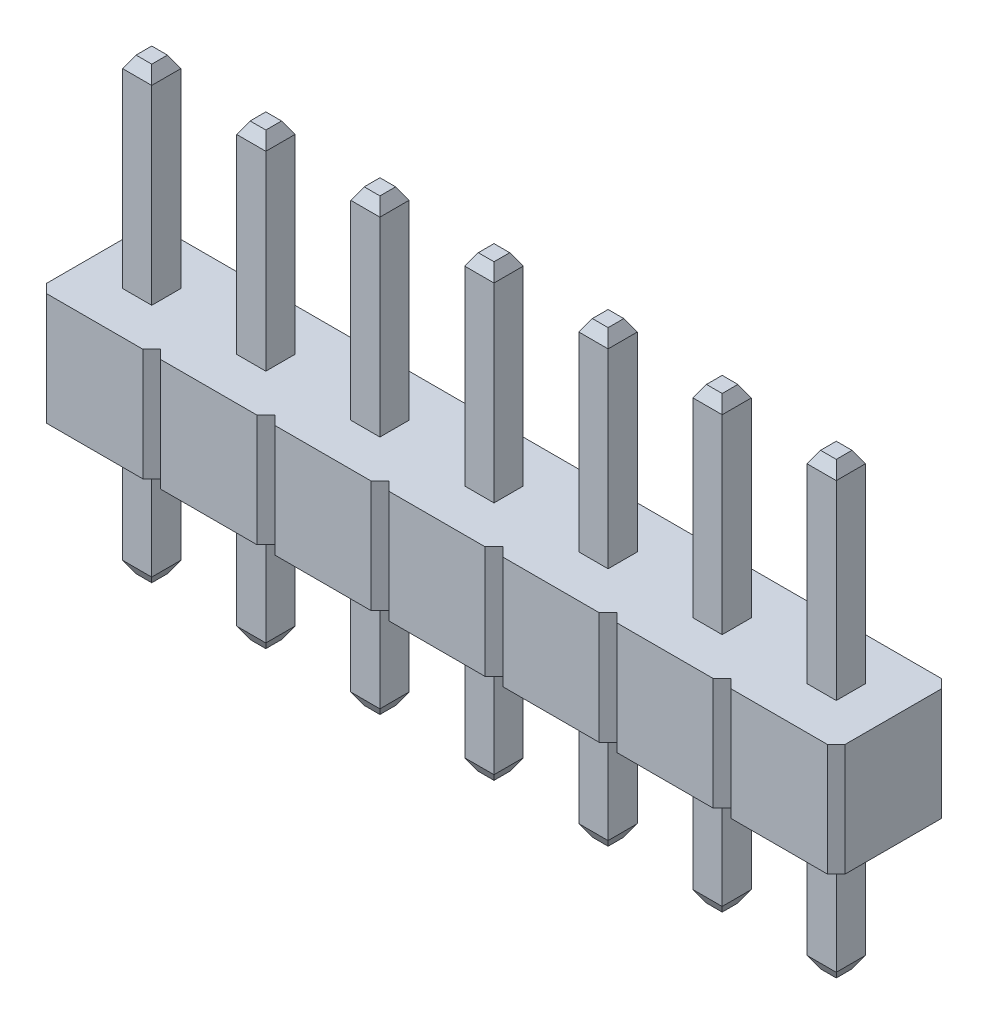
from build123d import *

# Parameters (mm, degrees)
BOSS_EXTRUDE1_DEPTH   = 2.5
SKETCH3_W             = 0.65
SKETCH3_H             = 0.65
BOSS_EXTRUDE2_DEPTH   = 10
CHAMFER2_SIZE         = 0.15
CHAMFER2_SIZE2        = 0.259807621
CHAMFER3_SIZE         = 0.15
CHAMFER3_SIZE2        = 0.259807621
LPATTERN2_DEPTH       = 2.5
LPATTERN2_START       = -2.740192379
LPATTERN2_2_OUTLINE_W = 0.65
LPATTERN2_2_OUTLINE_H = 0.65
LPATTERN2_2_DEPTH     = 9.480384758


with BuildPart() as part:
    # Sketch1 → Boss-Extrude1 (new body)
    with BuildSketch(Plane(origin=(0, 0, 0), x_dir=(1, 0, 0), z_dir=(0, 1, 0))):
        Polygon((-7.42, 1.27), (-7.62, 1.07), (-7.62, -1.07), (-7.42, -1.27), (-5.28, -1.27), (-5.08, -1.07), (-5.08, 1.07), (-5.28, 1.27), align=None)
    extrude(amount=BOSS_EXTRUDE1_DEPTH)

    # Sketch3 → Boss-Extrude2 (add)
    with BuildSketch(Plane(origin=(0, -3, 0), x_dir=(1, 0, 0), z_dir=(0, 1, 0))):
        with Locations((-6.35, 0)):
            Rectangle(SKETCH3_W, SKETCH3_H)
    extrude(amount=BOSS_EXTRUDE2_DEPTH)

    # Chamfer2
    chamfer2_edges = [part.edges().sort_by_distance(p)[0] for p in [
        (-6.025, -3, 0),
        (-6.35, -3, -0.325),
        (-6.675, -3, 0),
        (-6.35, -3, 0.325),
    ]]
    chamfer2_side = [part.faces().sort_by_distance(p)[0] for p in [
        (-6.35, -3, 0),
    ]]
    chamfer(chamfer2_edges, length=CHAMFER2_SIZE, length2=CHAMFER2_SIZE2, reference=chamfer2_side[0])

    # Chamfer3
    chamfer3_edges = [part.edges().sort_by_distance(p)[0] for p in [
        (-6.025, 7, 0),
        (-6.35, 7, -0.325),
        (-6.675, 7, 0),
        (-6.35, 7, 0.325),
    ]]
    chamfer3_side = [part.faces().sort_by_distance(p)[0] for p in [
        (-6.35, 7, 0),
    ]]
    chamfer(chamfer3_edges, length=CHAMFER3_SIZE, length2=CHAMFER3_SIZE2, reference=chamfer3_side[0])

    # LPattern2: read off the stored shape, not the designer's step
    # LPattern2 outline → LPattern2 (add)
    with BuildSketch(Plane(origin=(0, 0, 0), x_dir=(1, 0, 0), z_dir=(0, 1, 0))):
        Polygon((-2.74, 1.27), (-4.88, 1.27), (-5.08, 1.07), (-5.08, -1.07), (-4.88, -1.27), (-2.74, -1.27), (-2.54, -1.07), (-2.34, -1.27), (-0.2, -1.27), (0, -1.07), (0.2, -1.27), (2.34, -1.27), (2.54, -1.07), (2.74, -1.27), (4.88, -1.27), (5.08, -1.07), (5.28, -1.27), (7.42, -1.27), (7.62, -1.07), (7.82, -1.27), (9.96, -1.27), (10.16, -1.07), (10.16, 1.07), (9.96, 1.27), (7.82, 1.27), (7.62, 1.07), (7.42, 1.27), (5.28, 1.27), (5.08, 1.07), (4.88, 1.27), (2.74, 1.27), (2.54, 1.07), (2.34, 1.27), (0.2, 1.27), (0, 1.07), (-0.2, 1.27), (-2.34, 1.27), (-2.54, 1.07), align=None)
    extrude(amount=LPATTERN2_DEPTH)

    # LPattern2 2 outline → LPattern2 2 (add)
    with BuildSketch(Plane(origin=(0, 0, 0), x_dir=(1, 0, 0), z_dir=(0, 1, 0)).offset(LPATTERN2_START)):
        with Locations((-3.81, 0)):
            Rectangle(LPATTERN2_2_OUTLINE_W, LPATTERN2_2_OUTLINE_H)
        with Locations((-1.27, 0)):
            Rectangle(LPATTERN2_2_OUTLINE_W, LPATTERN2_2_OUTLINE_H)
        with Locations((1.27, 0)):
            Rectangle(LPATTERN2_2_OUTLINE_W, LPATTERN2_2_OUTLINE_H)
        with Locations((3.81, 0)):
            Rectangle(LPATTERN2_2_OUTLINE_W, LPATTERN2_2_OUTLINE_H)
        with Locations((6.35, 0)):
            Rectangle(LPATTERN2_2_OUTLINE_W, LPATTERN2_2_OUTLINE_H)
        with Locations((8.89, 0)):
            Rectangle(LPATTERN2_2_OUTLINE_W, LPATTERN2_2_OUTLINE_H)
    extrude(amount=LPATTERN2_2_DEPTH)

    # LPattern2 3: loft between two sections, ruled curve by curve
    lpattern2_3_from = [
        Edge.make_line((-3.985, -3, 0.175), (-3.635, -3, 0.175)),
        Edge.make_line((-3.635, -3, -0.175), (-3.985, -3, -0.175)),
        Edge.make_line((-3.635, -3, 0.175), (-3.635, -3, -0.175)),
        Edge.make_line((-3.985, -3, 0.175), (-3.985, -3, -0.175)),
    ]
    lpattern2_3_to = [
        Edge.make_line((-4.135, -2.740192379, 0.325), (-3.485, -2.740192379, 0.325)),
        Edge.make_line((-3.485, -2.740192379, -0.325), (-4.135, -2.740192379, -0.325)),
        Edge.make_line((-3.485, -2.740192379, 0.325), (-3.485, -2.740192379, -0.325)),
        Edge.make_line((-4.135, -2.740192379, 0.325), (-4.135, -2.740192379, -0.325)),
    ]
    lpattern2_3 = Solid(Shell([*[Face.make_surface_from_curves(lpattern2_3_from[k], lpattern2_3_to[k]) for k in range(4)], Face(Wire(lpattern2_3_from)), Face(Wire(lpattern2_3_to))]))
    add(lpattern2_3)

    # LPattern2 4: loft between two sections, ruled curve by curve
    lpattern2_4_from = [
        Edge.make_line((-1.445, -3, 0.175), (-1.095, -3, 0.175)),
        Edge.make_line((-1.095, -3, -0.175), (-1.445, -3, -0.175)),
        Edge.make_line((-1.095, -3, 0.175), (-1.095, -3, -0.175)),
        Edge.make_line((-1.445, -3, 0.175), (-1.445, -3, -0.175)),
    ]
    lpattern2_4_to = [
        Edge.make_line((-1.595, -2.740192379, 0.325), (-0.945, -2.740192379, 0.325)),
        Edge.make_line((-0.945, -2.740192379, -0.325), (-1.595, -2.740192379, -0.325)),
        Edge.make_line((-0.945, -2.740192379, 0.325), (-0.945, -2.740192379, -0.325)),
        Edge.make_line((-1.595, -2.740192379, 0.325), (-1.595, -2.740192379, -0.325)),
    ]
    lpattern2_4 = Solid(Shell([*[Face.make_surface_from_curves(lpattern2_4_from[k], lpattern2_4_to[k]) for k in range(4)], Face(Wire(lpattern2_4_from)), Face(Wire(lpattern2_4_to))]))
    add(lpattern2_4)

    # LPattern2 5: loft between two sections, ruled curve by curve
    lpattern2_5_from = [
        Edge.make_line((1.095, -3, 0.175), (1.445, -3, 0.175)),
        Edge.make_line((1.445, -3, -0.175), (1.095, -3, -0.175)),
        Edge.make_line((1.445, -3, 0.175), (1.445, -3, -0.175)),
        Edge.make_line((1.095, -3, 0.175), (1.095, -3, -0.175)),
    ]
    lpattern2_5_to = [
        Edge.make_line((0.945, -2.740192379, 0.325), (1.595, -2.740192379, 0.325)),
        Edge.make_line((1.595, -2.740192379, -0.325), (0.945, -2.740192379, -0.325)),
        Edge.make_line((1.595, -2.740192379, 0.325), (1.595, -2.740192379, -0.325)),
        Edge.make_line((0.945, -2.740192379, 0.325), (0.945, -2.740192379, -0.325)),
    ]
    lpattern2_5 = Solid(Shell([*[Face.make_surface_from_curves(lpattern2_5_from[k], lpattern2_5_to[k]) for k in range(4)], Face(Wire(lpattern2_5_from)), Face(Wire(lpattern2_5_to))]))
    add(lpattern2_5)

    # LPattern2 6: loft between two sections, ruled curve by curve
    lpattern2_6_from = [
        Edge.make_line((3.635, -3, 0.175), (3.985, -3, 0.175)),
        Edge.make_line((3.985, -3, -0.175), (3.635, -3, -0.175)),
        Edge.make_line((3.985, -3, 0.175), (3.985, -3, -0.175)),
        Edge.make_line((3.635, -3, 0.175), (3.635, -3, -0.175)),
    ]
    lpattern2_6_to = [
        Edge.make_line((3.485, -2.740192379, 0.325), (4.135, -2.740192379, 0.325)),
        Edge.make_line((4.135, -2.740192379, -0.325), (3.485, -2.740192379, -0.325)),
        Edge.make_line((4.135, -2.740192379, 0.325), (4.135, -2.740192379, -0.325)),
        Edge.make_line((3.485, -2.740192379, 0.325), (3.485, -2.740192379, -0.325)),
    ]
    lpattern2_6 = Solid(Shell([*[Face.make_surface_from_curves(lpattern2_6_from[k], lpattern2_6_to[k]) for k in range(4)], Face(Wire(lpattern2_6_from)), Face(Wire(lpattern2_6_to))]))
    add(lpattern2_6)

    # LPattern2 7: loft between two sections, ruled curve by curve
    lpattern2_7_from = [
        Edge.make_line((6.175, -3, 0.175), (6.525, -3, 0.175)),
        Edge.make_line((6.525, -3, -0.175), (6.175, -3, -0.175)),
        Edge.make_line((6.525, -3, 0.175), (6.525, -3, -0.175)),
        Edge.make_line((6.175, -3, 0.175), (6.175, -3, -0.175)),
    ]
    lpattern2_7_to = [
        Edge.make_line((6.025, -2.740192379, 0.325), (6.675, -2.740192379, 0.325)),
        Edge.make_line((6.675, -2.740192379, -0.325), (6.025, -2.740192379, -0.325)),
        Edge.make_line((6.675, -2.740192379, 0.325), (6.675, -2.740192379, -0.325)),
        Edge.make_line((6.025, -2.740192379, 0.325), (6.025, -2.740192379, -0.325)),
    ]
    lpattern2_7 = Solid(Shell([*[Face.make_surface_from_curves(lpattern2_7_from[k], lpattern2_7_to[k]) for k in range(4)], Face(Wire(lpattern2_7_from)), Face(Wire(lpattern2_7_to))]))
    add(lpattern2_7)

    # LPattern2 8: loft between two sections, ruled curve by curve
    lpattern2_8_from = [
        Edge.make_line((8.715, -3, 0.175), (9.065, -3, 0.175)),
        Edge.make_line((9.065, -3, -0.175), (8.715, -3, -0.175)),
        Edge.make_line((9.065, -3, 0.175), (9.065, -3, -0.175)),
        Edge.make_line((8.715, -3, 0.175), (8.715, -3, -0.175)),
    ]
    lpattern2_8_to = [
        Edge.make_line((8.565, -2.740192379, 0.325), (9.215, -2.740192379, 0.325)),
        Edge.make_line((9.215, -2.740192379, -0.325), (8.565, -2.740192379, -0.325)),
        Edge.make_line((9.215, -2.740192379, 0.325), (9.215, -2.740192379, -0.325)),
        Edge.make_line((8.565, -2.740192379, 0.325), (8.565, -2.740192379, -0.325)),
    ]
    lpattern2_8 = Solid(Shell([*[Face.make_surface_from_curves(lpattern2_8_from[k], lpattern2_8_to[k]) for k in range(4)], Face(Wire(lpattern2_8_from)), Face(Wire(lpattern2_8_to))]))
    add(lpattern2_8)

    # LPattern2 9: loft between two sections, ruled curve by curve
    lpattern2_9_from = [
        Edge.make_line((-3.485, 6.740192379, -0.325), (-4.135, 6.740192379, -0.325)),
        Edge.make_line((-4.135, 6.740192379, 0.325), (-3.485, 6.740192379, 0.325)),
        Edge.make_line((-4.135, 6.740192379, -0.325), (-4.135, 6.740192379, 0.325)),
        Edge.make_line((-3.485, 6.740192379, -0.325), (-3.485, 6.740192379, 0.325)),
    ]
    lpattern2_9_to = [
        Edge.make_line((-3.635, 7, -0.175), (-3.985, 7, -0.175)),
        Edge.make_line((-3.985, 7, 0.175), (-3.635, 7, 0.175)),
        Edge.make_line((-3.985, 7, -0.175), (-3.985, 7, 0.175)),
        Edge.make_line((-3.635, 7, -0.175), (-3.635, 7, 0.175)),
    ]
    lpattern2_9 = Solid(Shell([*[Face.make_surface_from_curves(lpattern2_9_from[k], lpattern2_9_to[k]) for k in range(4)], Face(Wire(lpattern2_9_from)), Face(Wire(lpattern2_9_to))]))
    add(lpattern2_9)

    # LPattern2 10: loft between two sections, ruled curve by curve
    lpattern2_10_from = [
        Edge.make_line((-0.945, 6.740192379, -0.325), (-1.595, 6.740192379, -0.325)),
        Edge.make_line((-1.595, 6.740192379, 0.325), (-0.945, 6.740192379, 0.325)),
        Edge.make_line((-1.595, 6.740192379, -0.325), (-1.595, 6.740192379, 0.325)),
        Edge.make_line((-0.945, 6.740192379, -0.325), (-0.945, 6.740192379, 0.325)),
    ]
    lpattern2_10_to = [
        Edge.make_line((-1.095, 7, -0.175), (-1.445, 7, -0.175)),
        Edge.make_line((-1.445, 7, 0.175), (-1.095, 7, 0.175)),
        Edge.make_line((-1.445, 7, -0.175), (-1.445, 7, 0.175)),
        Edge.make_line((-1.095, 7, -0.175), (-1.095, 7, 0.175)),
    ]
    lpattern2_10 = Solid(Shell([*[Face.make_surface_from_curves(lpattern2_10_from[k], lpattern2_10_to[k]) for k in range(4)], Face(Wire(lpattern2_10_from)), Face(Wire(lpattern2_10_to))]))
    add(lpattern2_10)

    # LPattern2 11: loft between two sections, ruled curve by curve
    lpattern2_11_from = [
        Edge.make_line((1.595, 6.740192379, -0.325), (0.945, 6.740192379, -0.325)),
        Edge.make_line((0.945, 6.740192379, 0.325), (1.595, 6.740192379, 0.325)),
        Edge.make_line((0.945, 6.740192379, -0.325), (0.945, 6.740192379, 0.325)),
        Edge.make_line((1.595, 6.740192379, -0.325), (1.595, 6.740192379, 0.325)),
    ]
    lpattern2_11_to = [
        Edge.make_line((1.445, 7, -0.175), (1.095, 7, -0.175)),
        Edge.make_line((1.095, 7, 0.175), (1.445, 7, 0.175)),
        Edge.make_line((1.095, 7, -0.175), (1.095, 7, 0.175)),
        Edge.make_line((1.445, 7, -0.175), (1.445, 7, 0.175)),
    ]
    lpattern2_11 = Solid(Shell([*[Face.make_surface_from_curves(lpattern2_11_from[k], lpattern2_11_to[k]) for k in range(4)], Face(Wire(lpattern2_11_from)), Face(Wire(lpattern2_11_to))]))
    add(lpattern2_11)

    # LPattern2 12: loft between two sections, ruled curve by curve
    lpattern2_12_from = [
        Edge.make_line((4.135, 6.740192379, -0.325), (3.485, 6.740192379, -0.325)),
        Edge.make_line((3.485, 6.740192379, 0.325), (4.135, 6.740192379, 0.325)),
        Edge.make_line((3.485, 6.740192379, -0.325), (3.485, 6.740192379, 0.325)),
        Edge.make_line((4.135, 6.740192379, -0.325), (4.135, 6.740192379, 0.325)),
    ]
    lpattern2_12_to = [
        Edge.make_line((3.985, 7, -0.175), (3.635, 7, -0.175)),
        Edge.make_line((3.635, 7, 0.175), (3.985, 7, 0.175)),
        Edge.make_line((3.635, 7, -0.175), (3.635, 7, 0.175)),
        Edge.make_line((3.985, 7, -0.175), (3.985, 7, 0.175)),
    ]
    lpattern2_12 = Solid(Shell([*[Face.make_surface_from_curves(lpattern2_12_from[k], lpattern2_12_to[k]) for k in range(4)], Face(Wire(lpattern2_12_from)), Face(Wire(lpattern2_12_to))]))
    add(lpattern2_12)

    # LPattern2 13: loft between two sections, ruled curve by curve
    lpattern2_13_from = [
        Edge.make_line((6.675, 6.740192379, -0.325), (6.025, 6.740192379, -0.325)),
        Edge.make_line((6.025, 6.740192379, 0.325), (6.675, 6.740192379, 0.325)),
        Edge.make_line((6.025, 6.740192379, -0.325), (6.025, 6.740192379, 0.325)),
        Edge.make_line((6.675, 6.740192379, -0.325), (6.675, 6.740192379, 0.325)),
    ]
    lpattern2_13_to = [
        Edge.make_line((6.525, 7, -0.175), (6.175, 7, -0.175)),
        Edge.make_line((6.175, 7, 0.175), (6.525, 7, 0.175)),
        Edge.make_line((6.175, 7, -0.175), (6.175, 7, 0.175)),
        Edge.make_line((6.525, 7, -0.175), (6.525, 7, 0.175)),
    ]
    lpattern2_13 = Solid(Shell([*[Face.make_surface_from_curves(lpattern2_13_from[k], lpattern2_13_to[k]) for k in range(4)], Face(Wire(lpattern2_13_from)), Face(Wire(lpattern2_13_to))]))
    add(lpattern2_13)

    # LPattern2 14: loft between two sections, ruled curve by curve
    lpattern2_14_from = [
        Edge.make_line((9.215, 6.740192379, -0.325), (8.565, 6.740192379, -0.325)),
        Edge.make_line((8.565, 6.740192379, 0.325), (9.215, 6.740192379, 0.325)),
        Edge.make_line((8.565, 6.740192379, -0.325), (8.565, 6.740192379, 0.325)),
        Edge.make_line((9.215, 6.740192379, -0.325), (9.215, 6.740192379, 0.325)),
    ]
    lpattern2_14_to = [
        Edge.make_line((9.065, 7, -0.175), (8.715, 7, -0.175)),
        Edge.make_line((8.715, 7, 0.175), (9.065, 7, 0.175)),
        Edge.make_line((8.715, 7, -0.175), (8.715, 7, 0.175)),
        Edge.make_line((9.065, 7, -0.175), (9.065, 7, 0.175)),
    ]
    lpattern2_14 = Solid(Shell([*[Face.make_surface_from_curves(lpattern2_14_from[k], lpattern2_14_to[k]) for k in range(4)], Face(Wire(lpattern2_14_from)), Face(Wire(lpattern2_14_to))]))
    add(lpattern2_14)


solid = part.part
